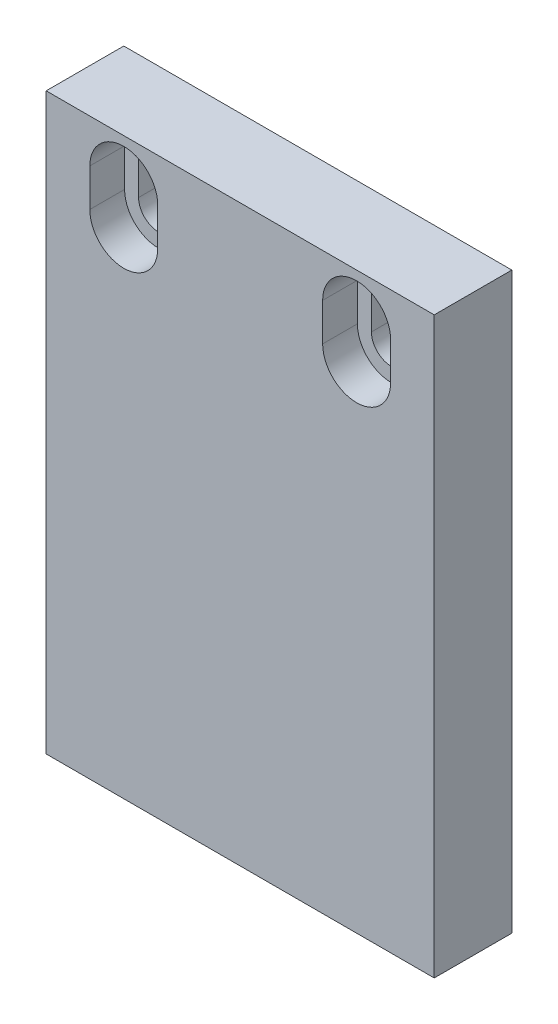
from build123d import *

# Parameters (mm, degrees)
SKETCH1_W                                     = 31.75
SKETCH1_H                                     = 6.35
BOSS_EXTRUDE1_DEPTH                           = 46.99
F_4_40_TAPPED_HOLE1_D                         = 2.2606
F_4_40_TAPPED_HOLE1_DEPTH                     = 7.5946
F_4_40_TAPPED_HOLE1_TIP                       = 0.679152758
CBORE_START                                   = 0.3302
CBORE_SLOT_FOR_4_SOCKET_HEAD_CAP_SCREW1_DEPTH = 2.8448
CBORE_START_2                                 = -3.175
CBORE_SLOT_FOR_4_SOCKET_HEAD_CAP_SC_3_DEPTH   = 3.5052


# Read off the part's stored shape, not the designer's step: CBORE SLOT for #4 Socket Head Cap Screw1
with BuildPart() as part:
    # Sketch1 → Boss-Extrude1 (new body)
    with BuildSketch(Plane(origin=(0, 0, 0), x_dir=(1, 0, 0), z_dir=(0, 1, 0))):
        Rectangle(SKETCH1_W, SKETCH1_H)
    extrude(amount=BOSS_EXTRUDE1_DEPTH)

    # #4-40 Tapped Hole1
    with Locations(Plane(origin=(0, 0, 0), x_dir=(-1, 0, 0), z_dir=(0, -1, 0))):
        with Locations((9.525, 0), (-9.525, 0)):
            Hole(F_4_40_TAPPED_HOLE1_D / 2, depth=F_4_40_TAPPED_HOLE1_DEPTH)
            with Locations((0, 0, -(F_4_40_TAPPED_HOLE1_DEPTH + F_4_40_TAPPED_HOLE1_TIP / 2))):  # 118° drill point
                Cone(0, F_4_40_TAPPED_HOLE1_D / 2, F_4_40_TAPPED_HOLE1_TIP, mode=Mode.SUBTRACT)

    # CBORE SLOT for _4 Socket Head Cap Sc 2 → CBORE SLOT for #4 Socket Head Cap Screw1 (cut)
    with BuildSketch(Plane.XY.offset(CBORE_START)):
        with BuildLine():
            Line((-6.74624, 40.36695), (-6.74624, 43.45305))
            ThreePointArc((-6.74624, 43.45305), (-9.525, 46.23181), (-12.30376, 43.45305))
            Line((-12.30376, 43.45305), (-12.30376, 40.36695))
            ThreePointArc((-12.30376, 40.36695), (-9.525, 37.58819), (-6.74624, 40.36695))
        make_face()
        with BuildLine():
            Line((12.30376, 40.36695), (12.30376, 43.45305))
            ThreePointArc((12.30376, 43.45305), (9.525, 46.23181), (6.74624, 43.45305))
            Line((6.74624, 43.45305), (6.74624, 40.36695))
            ThreePointArc((6.74624, 40.36695), (9.525, 37.58819), (12.30376, 40.36695))
        make_face()
    extrude(amount=CBORE_SLOT_FOR_4_SOCKET_HEAD_CAP_SCREW1_DEPTH, mode=Mode.SUBTRACT)

    # CBORE SLOT for _4 Socket Head Cap Sc 3 o → CBORE SLOT for _4 Socket Head Cap Sc 3 (cut)
    with BuildSketch(Plane.XY.offset(CBORE_START_2)):
        with BuildLine():
            ThreePointArc((-7.89305, 43.45305), (-9.525, 45.085), (-11.15695, 43.45305))
            Line((-11.15695, 43.45305), (-11.15695, 40.36695))
            ThreePointArc((-11.15695, 40.36695), (-9.525, 38.735), (-7.89305, 40.36695))
            Line((-7.89305, 40.36695), (-7.89305, 43.45305))
        make_face()
        with BuildLine():
            Line((7.89305, 43.45305), (7.89305, 40.36695))
            ThreePointArc((7.89305, 40.36695), (9.525, 38.735), (11.15695, 40.36695))
            Line((11.15695, 40.36695), (11.15695, 43.45305))
            ThreePointArc((11.15695, 43.45305), (9.525, 45.085), (7.89305, 43.45305))
        make_face()
    extrude(amount=CBORE_SLOT_FOR_4_SOCKET_HEAD_CAP_SC_3_DEPTH, mode=Mode.SUBTRACT)


solid = part.part
